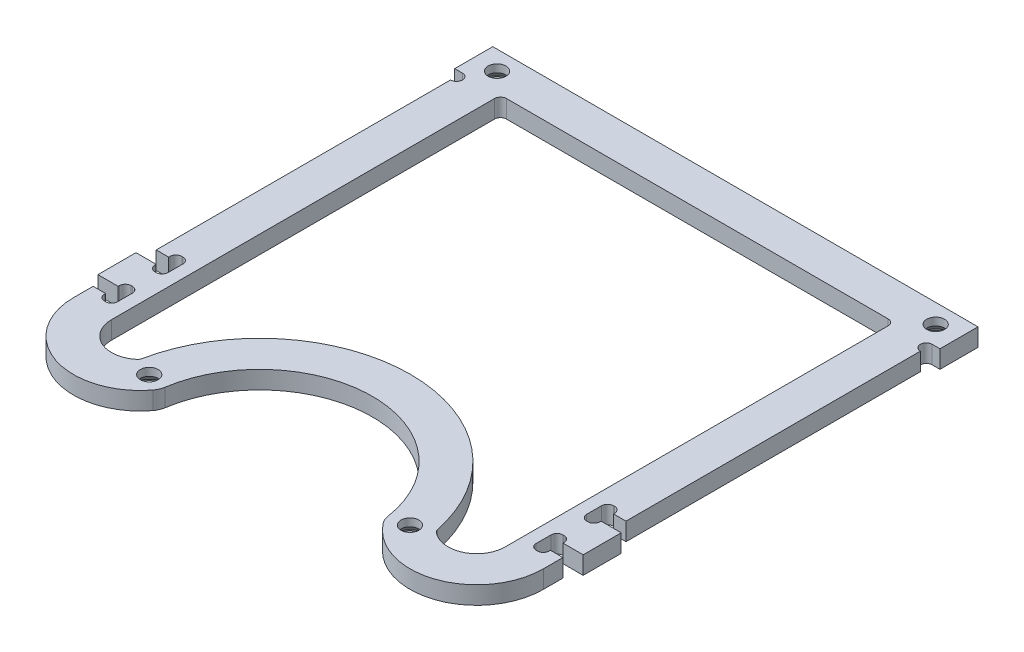
from build123d import *

# Parameters (mm, degrees)
SKETCH1_R                  = 1.5
SHAPE_DEPTH                = 3
MILL_FILLETS_R             = 1
M3_COUNTERSUNKS_AT_2_COUNT = 2
M3_COUNTERSUNKS_AT_2_PITCH = 43.84
M3_COUNTERSUNKS_AT_3_COUNT = 2
M3_COUNTERSUNKS_AT_3_PITCH = 94.086888034
M3_COUNTERSUNKS_AT_4_COUNT = 2
M3_COUNTERSUNKS_AT_4_PITCH = 74.958015582


with BuildPart() as part:
    # Sketch1 → Shape (new body)
    with BuildSketch(Plane(origin=(0, 0, 0), x_dir=(1, 0, 0), z_dir=(0, 1, 0))):
        with BuildLine():
            Line((-39.5, 31.525), (-39.5, -17.975))
            Line((-39.5, -17.975), (-37.4, -17.975))
            Line((-37.4, -17.975), (-37.4, -16.775))
            Line((-37.4, -16.775), (-35.2, -16.775))
            Line((-35.2, -16.775), (-35.2, -21.275))
            Line((-35.2, -21.275), (-37.4, -21.275))
            Line((-37.4, -21.275), (-37.4, -20.075))
            Line((-37.4, -20.075), (-40.8, -20.075))
            Line((-40.8, -20.075), (-40.8, -26.475))
            Line((-40.8, -26.475), (-37.4, -26.475))
            Line((-37.4, -26.475), (-37.4, -25.275))
            Line((-37.4, -25.275), (-35.2, -25.275))
            Line((-35.2, -25.275), (-35.2, -29.775))
            Line((-35.2, -29.775), (-37.4, -29.775))
            Line((-37.4, -29.775), (-37.4, -28.575))
            Line((-37.4, -28.575), (-39.5, -28.575))
            Line((-39.5, -28.575), (-39.5, -31.875))
            ThreePointArc((-39.5, -31.875), (-31.873999392, -42.495115722), (-19.373666911, -38.663088698))
            ThreePointArc((-19.373666911, -38.663088698), (-18.974560125, -37.975753351), (-18.757160547, -37.211257746))
            ThreePointArc((-18.757160547, -37.211257746), (1.83e-07, -21.117459559), (18.757160603, -37.211258109))
            ThreePointArc((18.757160603, -37.211258109), (18.974560197, -37.97575352), (19.373666911, -38.663088698))
            ThreePointArc((19.373666911, -38.663088698), (31.873999392, -42.495115722), (39.5, -31.875))
            Line((39.5, -31.875), (39.5, -28.575))
            Line((39.5, -28.575), (37.4, -28.575))
            Line((37.4, -28.575), (37.4, -29.775))
            Line((37.4, -29.775), (35.2, -29.775))
            Line((35.2, -29.775), (35.2, -25.275))
            Line((35.2, -25.275), (37.4, -25.275))
            Line((37.4, -25.275), (37.4, -26.475))
            Line((37.4, -26.475), (40.8, -26.475))
            Line((40.8, -26.475), (40.8, -20.075))
            Line((40.8, -20.075), (37.4, -20.075))
            Line((37.4, -20.075), (37.4, -21.275))
            Line((37.4, -21.275), (35.2, -21.275))
            Line((35.2, -21.275), (35.2, -16.775))
            Line((35.2, -16.775), (37.4, -16.775))
            Line((37.4, -16.775), (37.4, -17.975))
            Line((37.4, -17.975), (39.5, -17.975))
            Line((39.5, -17.975), (39.5, 31.525))
            ThreePointArc((39.5, 31.525), (38.5, 32.525), (39.5, 33.525))
            Line((39.5, 33.525), (40.8, 33.525))
            Line((40.8, 33.525), (40.8, 39.925))
            Line((40.8, 39.925), (-40.8, 39.925))
            Line((-40.8, 39.925), (-40.8, 33.525))
            Line((-40.8, 33.525), (-39.5, 33.525))
            ThreePointArc((-39.5, 33.525), (-38.5, 32.525), (-39.5, 31.525))
        make_face()
        with BuildLine():
            Line((-33.1, 33.525), (33.1, 33.525))
            Line((33.1, 33.525), (33.1, -31.875))
            ThreePointArc((33.1, -31.875), (30.150593633, -36.309167506), (24.921009297, -35.303042732))
            ThreePointArc((24.921009297, -35.303042732), (0, -14.717459559), (-24.921009297, -35.303042732))
            ThreePointArc((-24.921009297, -35.303042732), (-30.150593633, -36.309167506), (-33.1, -31.875))
            Line((-33.1, -31.875), (-33.1, 33.525))
        make_face(mode=Mode.SUBTRACT)
        with Locations((-36.88, 36.725)):
            Circle(SKETCH1_R, mode=Mode.SUBTRACT)
        with Locations((36.88, 36.725)):
            Circle(SKETCH1_R, mode=Mode.SUBTRACT)
        with Locations((21.92, -36.725)):
            Circle(SKETCH1_R, mode=Mode.SUBTRACT)
        with Locations((-21.92, -36.725)):
            Circle(SKETCH1_R, mode=Mode.SUBTRACT)
    extrude(amount=SHAPE_DEPTH)

    # Mill fillets
    mill_fillets_edges = [part.edges().sort_by_distance(p)[0] for p in [
        (37.4, 1.5, 21.275),
        (35.2, 1.5, 21.275),
        (35.2, 1.5, 16.775),
        (37.4, 1.5, 16.775),
        (37.4, 1.5, 25.275),
        (35.2, 1.5, 25.275),
        (37.4, 1.5, 29.775),
        (35.2, 1.5, 29.775),
        (-37.4, 1.5, 21.275),
        (-35.2, 1.5, 21.275),
        (-35.2, 1.5, 16.775),
        (-37.4, 1.5, 16.775),
        (-37.4, 1.5, 25.275),
        (-35.2, 1.5, 25.275),
        (-35.2, 1.5, 29.775),
        (-37.4, 1.5, 29.775),
        (-24.921009297, 1.5, 35.303042732),
        (24.921009297, 1.5, 35.303042732),
        (33.1, 1.5, -33.525),
        (-33.1, 1.5, -33.525),
    ]]
    fillet(mill_fillets_edges, radius=MILL_FILLETS_R)

    # Sketch3 → M3 countersunks (revolve, cut)
    with BuildSketch(Plane(origin=(-21.92, 0, 36.725), x_dir=(0, 0, -1), z_dir=(1, 0, 0))):
        Polygon((0, 0), (0, 3), (1.5, 3), (1.5, 1.7), (3, 0.2), (3, 0), align=None)
    m3_countersunks = revolve(axis=Axis((-21.92, -6.35, 36.725), (0, 1, 0)), mode=Mode.SUBTRACT)

    # M3 countersunks at 2: M3 countersunks ×2
    with Locations(*[(i * M3_COUNTERSUNKS_AT_2_PITCH, 0, 0) for i in range(1, M3_COUNTERSUNKS_AT_2_COUNT)]):
        add(m3_countersunks, mode=Mode.SUBTRACT)

    # M3 countersunks at 3: M3 countersunks ×2
    with Locations(*[Vector(0.6249542441928148, 0, -0.7806613815639838) * (i * M3_COUNTERSUNKS_AT_3_PITCH) for i in range(1, M3_COUNTERSUNKS_AT_3_COUNT)]):
        add(m3_countersunks, mode=Mode.SUBTRACT)

    # M3 countersunks at 4: M3 countersunks ×2
    with Locations(*[Vector(-0.19957838910000314, 0, -0.9798818635959377) * (i * M3_COUNTERSUNKS_AT_4_PITCH) for i in range(1, M3_COUNTERSUNKS_AT_4_COUNT)]):
        add(m3_countersunks, mode=Mode.SUBTRACT)


solid = part.part
